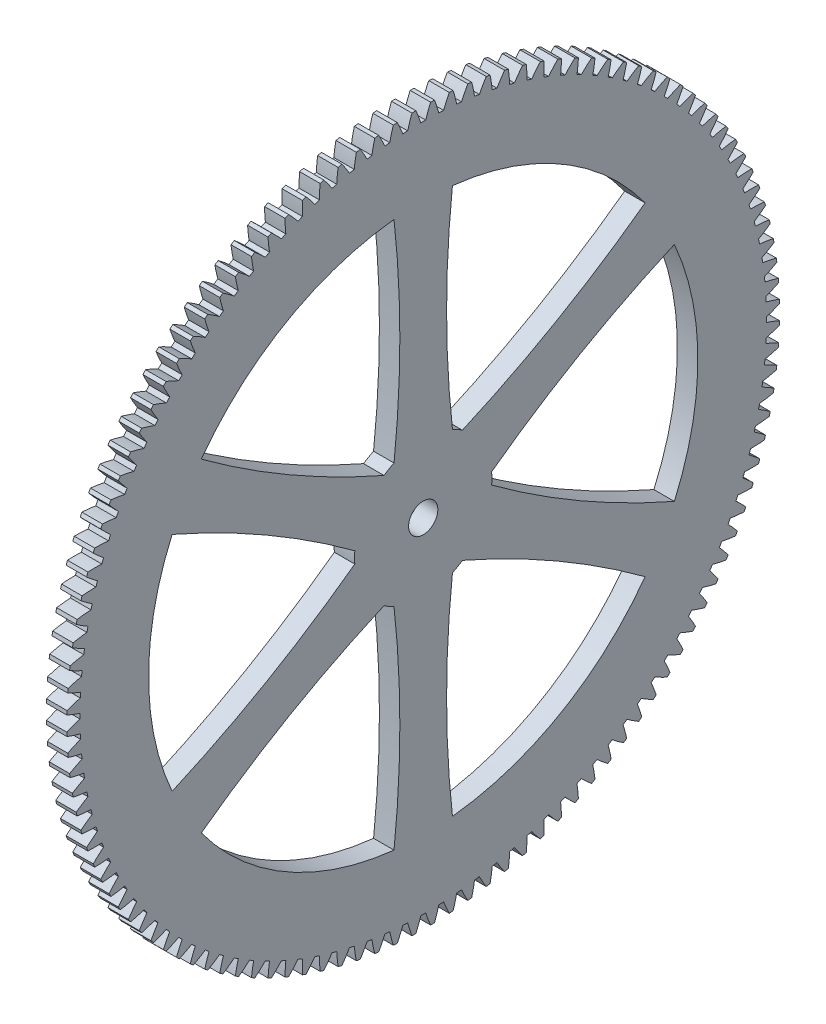
from build123d import *

# Parameters (mm, degrees)
BASPROSKE_W        = 4.445
BASPROSKE_H        = 77.47
TOOTHCUT_DEPTH     = 110.649258205
TEETHCUTS_COUNT    = 120
TEETHCUTS_ANGLE    = 357
BORSKE_R           = 3.175
BORE_DEPTH         = 50.8000508
CUT_EXTRUDE1_DEPTH = 110.625763462


with BuildPart() as part:
    # BasProSke → Base-Revolve (revolve)
    with BuildSketch(Plane(origin=(0, 0, 0), x_dir=(1, 0, 0), z_dir=(0, 1, 0))):
        with Locations((2.2225, 38.735)):
            Rectangle(BASPROSKE_W, BASPROSKE_H)
    revolve(axis=Axis((-10, 0, 0), (1, 0, 0)))

    # TooCutSke → ToothCut (cut, through all)
    with BuildSketch(Plane(origin=(0, 0, 0), x_dir=(0, 0, -1), z_dir=(1, 0, 0))):
        with BuildLine():
            ThreePointArc((0.530468489, 74.623314575), (0, 74.6252), (-0.530468489, 74.623314575))
            ThreePointArc((-0.530468489, 74.623314575), (-1.037441082, 76.064538991), (-1.615994644, 77.478549176))
            ThreePointArc((-1.615994644, 77.478549176), (0, 77.4954), (1.615994644, 77.478549176))
            ThreePointArc((1.615994644, 77.478549176), (1.037441082, 76.064538991), (0.530468489, 74.623314575))
        make_face()
    toothcut = extrude(amount=TOOTHCUT_DEPTH, mode=Mode.SUBTRACT)

    # TeethCuts: ToothCut ×120 about axis
    teethcuts_axis = Axis((-10, 0, 0), (1, 0, 0))
    for i in range(1, TEETHCUTS_COUNT):
        add(toothcut.rotate(teethcuts_axis, i * TEETHCUTS_ANGLE / (TEETHCUTS_COUNT - 1)), mode=Mode.SUBTRACT)

    # BorSke → Bore (cut, symmetric)
    with BuildSketch(Plane(origin=(0, 0, 0), x_dir=(0, 0, -1), z_dir=(1, 0, 0))):
        Circle(BORSKE_R)
    extrude(amount=BORE_DEPTH, both=True, mode=Mode.SUBTRACT)

    # Sketch2 → Cut-Extrude1 (cut, through all)
    with BuildSketch(Plane.ZY):
        with BuildLine():
            ThreePointArc((-6.35, 13.506824905), (-5.08, 36.434157911), (-6.35, 59.361490918))
            ThreePointArc((-6.35, 59.361490918), (-29.85008, 51.70185517), (-48.233559142, 35.180006773))
            ThreePointArc((-48.233559142, 35.180006773), (-29.012906317, 22.616488007), (-8.522253492, 12.252673766))
            ThreePointArc((-8.522253492, 12.252673766), (-7.46252, 12.925463792), (-6.35, 13.506824905))
        make_face()
        with BuildLine():
            ThreePointArc((48.233559142, 35.180006773), (29.85008, 51.70185517), (6.35, 59.361490918))
            ThreePointArc((6.35, 59.361490918), (5.08, 36.434157911), (6.35, 13.506824905))
            ThreePointArc((6.35, 13.506824905), (7.46252, 12.925463792), (8.522253492, 12.252673766))
            ThreePointArc((8.522253492, 12.252673766), (29.012906317, 22.616488007), (48.233559142, 35.180006773))
        make_face()
        with BuildLine():
            ThreePointArc((-14.872253492, 1.254151138), (-34.092906317, 13.817669904), (-54.583559142, 24.181484145))
            ThreePointArc((-54.583559142, 24.181484145), (-59.70016, 0), (-54.583559142, -24.181484145))
            ThreePointArc((-54.583559142, -24.181484145), (-34.092906317, -13.817669904), (-14.872253492, -1.254151138))
            ThreePointArc((-14.872253492, -1.254151138), (-14.92504, 0), (-14.872253492, 1.254151138))
        make_face()
        with BuildLine():
            ThreePointArc((54.583559142, -24.181484145), (59.70016, 0), (54.583559142, 24.181484145))
            ThreePointArc((54.583559142, 24.181484145), (34.092906317, 13.817669904), (14.872253492, 1.254151138))
            ThreePointArc((14.872253492, 1.254151138), (14.92504, 0), (14.872253492, -1.254151138))
            ThreePointArc((14.872253492, -1.254151138), (34.092906317, -13.817669904), (54.583559142, -24.181484145))
        make_face()
        with BuildLine():
            ThreePointArc((-8.522253492, -12.252673766), (-29.012906317, -22.616488007), (-48.233559142, -35.180006773))
            ThreePointArc((-48.233559142, -35.180006773), (-29.85008, -51.70185517), (-6.35, -59.361490918))
            ThreePointArc((-6.35, -59.361490918), (-5.08, -36.434157911), (-6.35, -13.506824905))
            ThreePointArc((-6.35, -13.506824905), (-7.46252, -12.925463792), (-8.522253492, -12.252673766))
        make_face()
        with BuildLine():
            ThreePointArc((6.35, -59.361490918), (29.85008, -51.70185517), (48.233559142, -35.180006773))
            ThreePointArc((48.233559142, -35.180006773), (29.012906317, -22.616488007), (8.522253492, -12.252673766))
            ThreePointArc((8.522253492, -12.252673766), (7.46252, -12.925463792), (6.35, -13.506824905))
            ThreePointArc((6.35, -13.506824905), (5.08, -36.434157911), (6.35, -59.361490918))
        make_face()
    extrude(amount=-CUT_EXTRUDE1_DEPTH, mode=Mode.SUBTRACT)


solid = part.part
